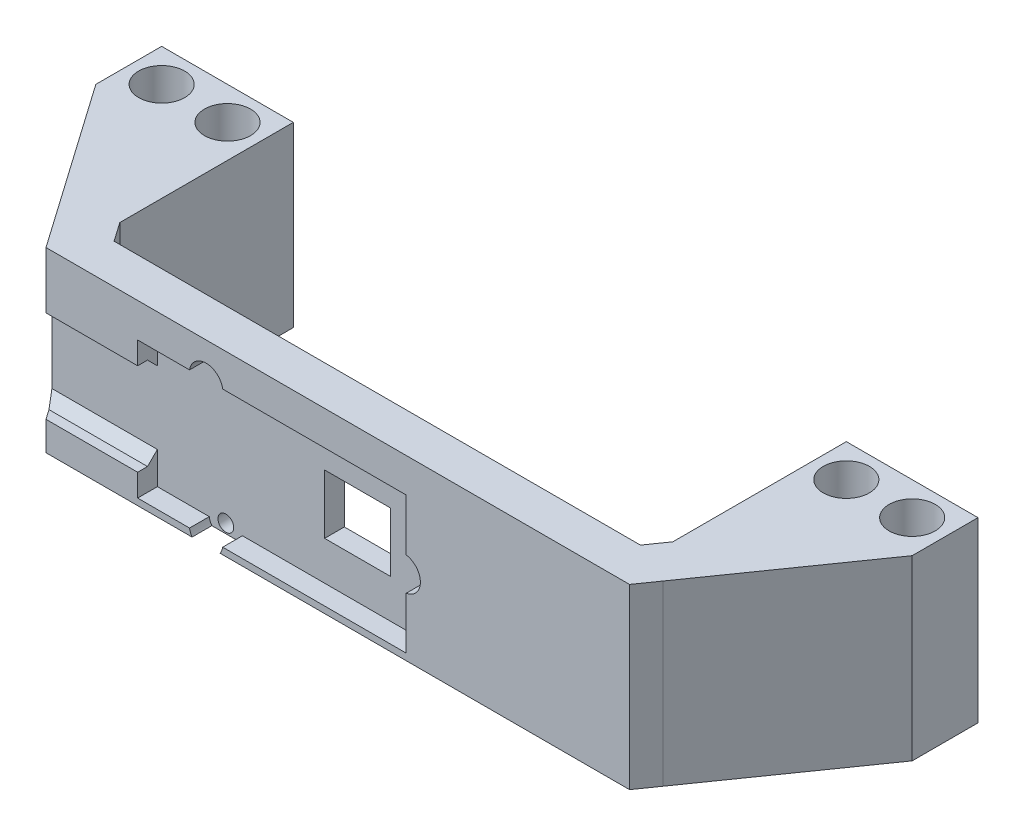
from build123d import *
from OCP.BRepFilletAPI import BRepFilletAPI_MakeChamfer

# Parameters (mm, degrees)
BOSS_EXTRUDE1_DEPTH                                 = 27
SKETCH2_W                                           = 10
SKETCH2_H                                           = 9
CUT_EXTRUDE1_DEPTH                                  = 75.920374398
CBORE_FOR_M3_PAN_HEAD_SCREW1_D                      = 3.4
CBORE_FOR_M3_PAN_HEAD_SCREW1_CBORE_D                = 7
CBORE_FOR_M3_PAN_HEAD_SCREW1_CBORE_DEPTH            = 8
CSK_FOR_M2_COUNTERSUNK_FLAT_HEAD_SCREW1_D           = 2.4
CSK_FOR_M2_COUNTERSUNK_FLAT_HEAD_SCREW1_CSINK_D     = 4.4
CSK_FOR_M2_COUNTERSUNK_FLAT_HEAD_SCREW1_CSINK_ANGLE = 90
BOSS_EXTRUDE2_DEPTH                                 = 3
CHAMFER1_SIZE                                       = 1.5
CHAMFER2_SIZE                                       = 3
CHAMFER2_SIZE_2                                     = 2.100622615


with BuildPart() as part:
    # Sketch1 → Boss-Extrude1 (new body)
    with BuildSketch(Plane(origin=(0, 0, 0), x_dir=(1, 0, 0), z_dir=(0, 1, 0))):
        Polygon((39.975582768, 0), (0, 0), (0, -3), (46.420382275, -3), (62, 19.25), (62, 29.25), (42, 29.25), (42, 2.891167435), align=None)
        Polygon((0, -3), (0, 0), (-39.975582768, 0), (-42, 2.891167435), (-42, 29.25), (-62, 29.25), (-62, 19.25), (-46.420382275, -3), align=None)
    extrude(amount=BOSS_EXTRUDE1_DEPTH)

    # Sketch2 → Cut-Extrude1 (cut, through all)
    with BuildSketch(Plane.XY.offset(3)):
        with Locations((0, 11.4)):
            Rectangle(SKETCH2_W, SKETCH2_H)
    extrude(amount=-CUT_EXTRUDE1_DEPTH, mode=Mode.SUBTRACT)

    # CBORE for M3 Pan Head Screw1 (through all)
    with Locations(Plane(origin=(0, 27, 0), x_dir=(1, 0, 0), z_dir=(0, 1, 0))):
        with Locations((-57, 24.25), (-47, 24.25), (47, 24.25), (57, 24.25)):
            CounterBoreHole(CBORE_FOR_M3_PAN_HEAD_SCREW1_D / 2, CBORE_FOR_M3_PAN_HEAD_SCREW1_CBORE_D / 2, CBORE_FOR_M3_PAN_HEAD_SCREW1_CBORE_DEPTH)

    # CSK for M2 Countersunk Flat Head Screw1 (through all)
    with Locations(Plane(origin=(0, 0, 0), x_dir=(1, 0, 0), z_dir=(0, 0, -1))):
        with Locations((-20, -21.400004303), (-20, -1.4), (10, -11.4)):
            CounterSinkHole(CSK_FOR_M2_COUNTERSUNK_FLAT_HEAD_SCREW1_D / 2, CSK_FOR_M2_COUNTERSUNK_FLAT_HEAD_SCREW1_CSINK_D / 2, counter_sink_angle=CSK_FOR_M2_COUNTERSUNK_FLAT_HEAD_SCREW1_CSINK_ANGLE)

    # Sketch7 → Boss-Extrude2 (add)
    with BuildSketch(Plane.XY.offset(3)):
        with BuildLine():
            Line((-30.4, 18.4), (-30.4, 21.8))
            Line((-30.4, 21.8), (-22.518432735, 21.8))
            ThreePointArc((-22.518432735, 21.8), (-20, 23.950004303), (-17.481567265, 21.8))
            Line((-17.481567265, 21.8), (10.4, 21.8))
            Line((10.4, 21.8), (10.4, 13.918432052))
            ThreePointArc((10.4, 13.918432052), (11.939394235, 13.055672069), (12.55, 11.4))
            ThreePointArc((12.55, 11.4), (11.939394235, 9.744327931), (10.4, 8.881567948))
            Line((10.4, 8.881567948), (10.4, 1))
            Line((10.4, 1), (-17.481567948, 1))
            ThreePointArc((-17.481567948, 1), (-17.621968265, 0.479421341), (-17.868685851, 0))
            Line((-17.868685851, 0), (46.420382275, 0))
            Line((46.420382275, 0), (46.420382275, 27))
            Line((46.420382275, 27), (-46.420382275, 27))
            Line((-46.420382275, 27), (-46.420382275, 18.4))
            Line((-46.420382275, 18.4), (-30.4, 18.4))
        make_face()
        with BuildLine():
            Line((-30.4, 1), (-30.4, 4.4))
            Line((-30.4, 4.4), (-46.420382275, 4.4))
            Line((-46.420382275, 4.4), (-46.420382275, 0))
            Line((-46.420382275, 0), (-22.131314149, 0))
            ThreePointArc((-22.131314149, 0), (-22.378031735, 0.479421341), (-22.518432052, 1))
            Line((-22.518432052, 1), (-30.4, 1))
        make_face()
    extrude(amount=BOSS_EXTRUDE2_DEPTH)

    # Chamfer1
    chamfer1_edges = [part.edges().sort_by_distance(p)[0] for p in [
        (-38.410191137, 18.4, 3),
        (-38.410191137, 4.4, 3),
    ]]
    chamfer(chamfer1_edges, length=CHAMFER1_SIZE)

    # Chamfer2
    chamfer2_edges_1 = [part.edges().sort_by_distance(p)[0] for p in [
        (46.420382275, 13.5, 6),
    ]]
    chamfer2_side_1 = [part.faces().sort_by_distance(p)[0] for p in [
        (46.420382275, 13.5, 5.957987548),
    ]]
    chamfer2_edges_2 = [part.edges().sort_by_distance(p)[0] for p in [
        (-46.420382275, 22.7, 6),
    ]]
    chamfer2_side_2 = [part.faces().sort_by_distance(p)[0] for p in [
        (-46.378369823, 22.7, 6),
    ]]
    chamfer2_edges_3 = [part.edges().sort_by_distance(p)[0] for p in [
        (-46.420382275, 2.2, 6),
    ]]
    chamfer2_side_3 = [part.faces().sort_by_distance(p)[0] for p in [
        (-46.378369823, 2.2, 6),
    ]]
    chamfer2 = BRepFilletAPI_MakeChamfer(part.part.solid().wrapped)
    for e in chamfer2_edges_1:
        chamfer2.Add(CHAMFER2_SIZE - 0.0001, CHAMFER2_SIZE_2 - 0.0001, e.wrapped, chamfer2_side_1[0].wrapped)
    for e in chamfer2_edges_2:
        chamfer2.Add(CHAMFER2_SIZE_2 - 0.0001, CHAMFER2_SIZE - 0.0001, e.wrapped, chamfer2_side_2[0].wrapped)
    for e in chamfer2_edges_3:
        chamfer2.Add(CHAMFER2_SIZE_2 - 0.0001, CHAMFER2_SIZE - 0.0001, e.wrapped, chamfer2_side_3[0].wrapped)
    add(Compound.cast(chamfer2.Shape()), mode=Mode.REPLACE)  # a hair under: the kernel refuses the full size


solid = part.part
